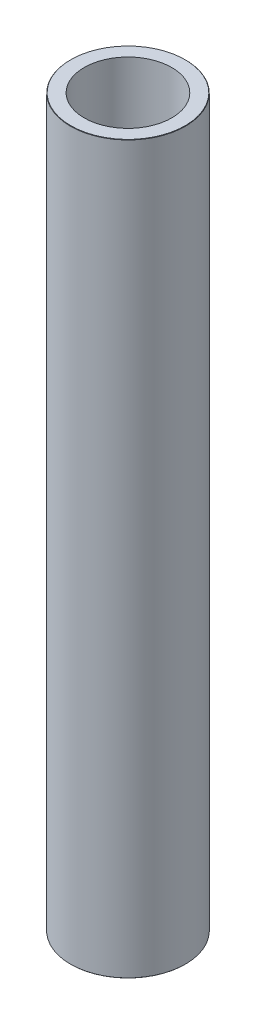
from build123d import *

# Parameters (mm, degrees)
SKETCH1_R           = 47.5
BOSS_EXTRUDE1_DEPTH = 600
SKETCH2_R           = 36.136693345
CUT_EXTRUDE1_DEPTH  = 604.748706003
CHAMFER1_SIZE       = 0.251061439


with BuildPart() as part:
    # Sketch1 → Boss-Extrude1 (new body)
    with BuildSketch(Plane(origin=(0, 0, 0), x_dir=(1, 0, 0), z_dir=(0, 1, 0))):
        Circle(SKETCH1_R)
    extrude(amount=BOSS_EXTRUDE1_DEPTH)

    # Sketch2 → Cut-Extrude1 (cut, through all)
    with BuildSketch(Plane(origin=(0, 0, 0), x_dir=(1, 0, 0), z_dir=(0, 1, 0))):
        Circle(SKETCH2_R)
    extrude(amount=CUT_EXTRUDE1_DEPTH, mode=Mode.SUBTRACT)

    # Chamfer1
    chamfer1_edges = [part.edges().sort_by_distance(p)[0] for p in [
        (-47.5, 600, 0),
        (-47.5, 0, 0),
    ]]
    chamfer(chamfer1_edges, length=CHAMFER1_SIZE)


solid = part.part
